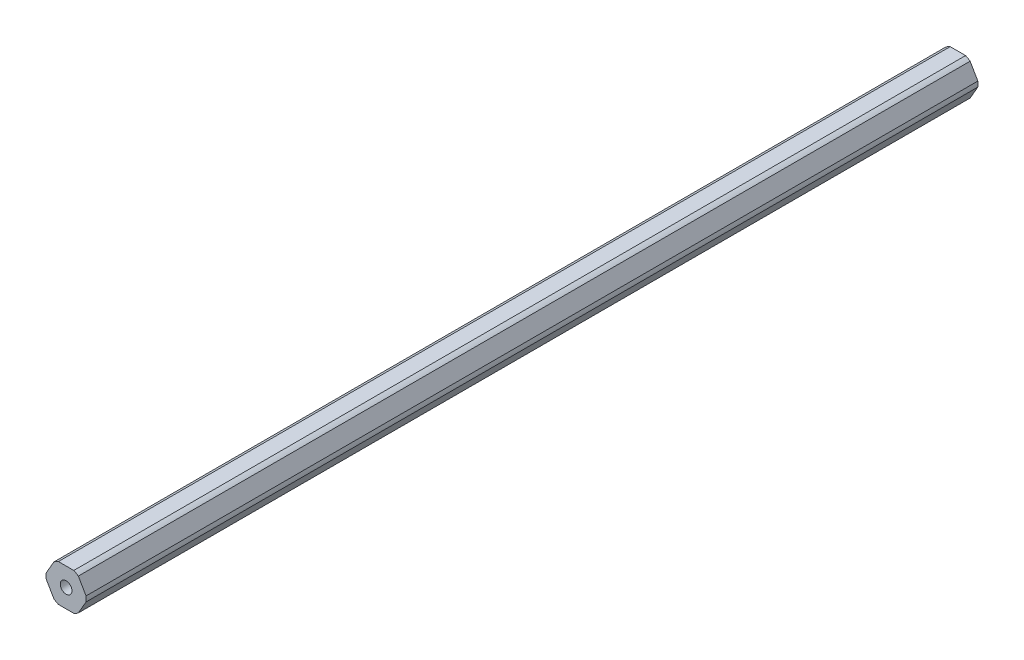
from build123d import *

# Parameters (mm, degrees)
SKETCH1_R           = 2.000000064
BOSS_EXTRUDE1_DEPTH = 152.4


with BuildPart() as part:
    # Sketch1 → Boss-Extrude1 (new, symmetric)
    with BuildSketch(Plane.XY):
        with BuildLine():
            ThreePointArc((4.181770846, 5.456960429), (3.437499983, 5.953924622), (2.634980936, 6.35))
            Line((2.634980936, 6.35), (-2.634980936, 6.35))
            ThreePointArc((-2.634980936, 6.35), (-3.437499983, 5.953924622), (-4.181770846, 5.456960429))
            Line((-4.181770846, 5.456960429), (-6.816751782, 0.893039571))
            ThreePointArc((-6.816751782, 0.893039571), (-6.874999966, 0), (-6.816751782, -0.893039571))
            Line((-6.816751782, -0.893039571), (-4.181770846, -5.456960429))
            ThreePointArc((-4.181770846, -5.456960429), (-3.437499983, -5.953924622), (-2.634980936, -6.35))
            Line((-2.634980936, -6.35), (2.634980936, -6.35))
            ThreePointArc((2.634980936, -6.35), (3.437499983, -5.953924622), (4.181770846, -5.456960429))
            Line((4.181770846, -5.456960429), (6.816751782, -0.893039571))
            ThreePointArc((6.816751782, -0.893039571), (6.860422465, -0.447468582), (6.874999966, 0))
            ThreePointArc((6.874999966, 0), (6.860422465, 0.447468582), (6.816751782, 0.893039571))
            Line((6.816751782, 0.893039571), (4.181770846, 5.456960429))
        make_face()
        Circle(SKETCH1_R, mode=Mode.SUBTRACT)
    extrude(amount=BOSS_EXTRUDE1_DEPTH, both=True)


solid = part.part
